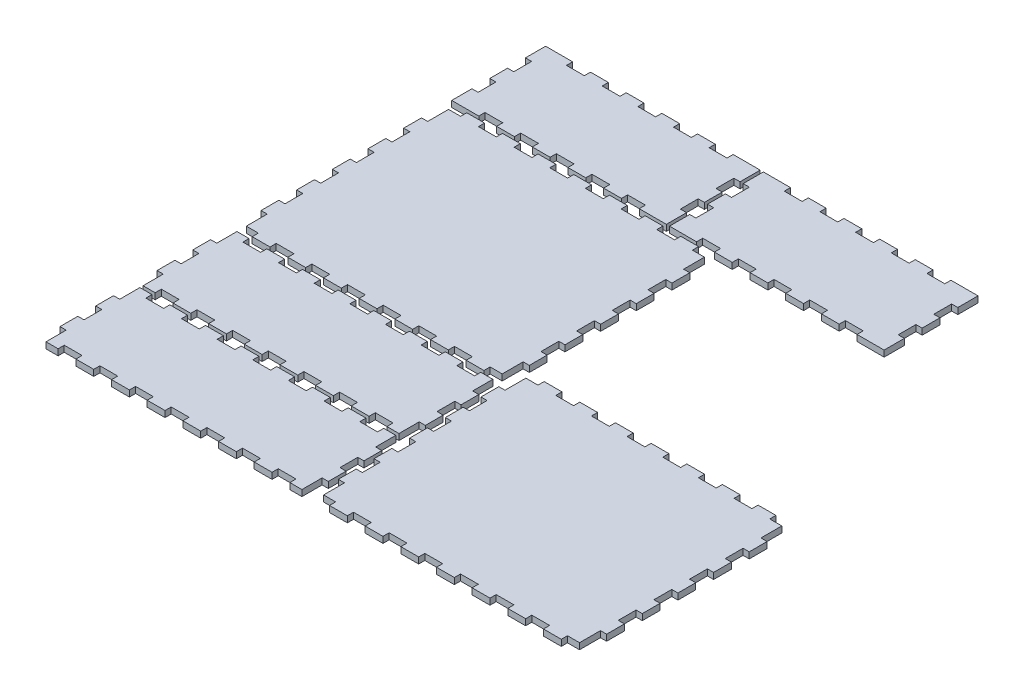
from build123d import *

# Parameters (mm, degrees)
BOSS_EXTRUDE2_DEPTH   = 5.842
BOSS_EXTRUDE2_2_DEPTH = 5.842
BOSS_EXTRUDE2_3_DEPTH = 5.842
BOSS_EXTRUDE2_4_DEPTH = 5.842
BOSS_EXTRUDE2_5_DEPTH = 5.842
BOSS_EXTRUDE2_6_DEPTH = 5.842


with BuildPart() as part:
    # Sketch6 → Boss-Extrude2 (new body)
    with BuildSketch(Plane(origin=(0, 0, 0), x_dir=(1, 0, 0), z_dir=(0, 1, 0))):
        Polygon((45.5168, 481.8888), (45.5168, 476.0468), (28.6258, 476.0468), (28.6258, 481.8888), (8.8392, 481.8888), (2.9972, 481.8888), (2.9972, 476.0468), (2.9972, 462.7626), (8.8392, 462.7626), (8.8392, 445.897), (2.9972, 445.897), (2.9972, 429.006), (8.8392, 429.006), (8.8392, 412.1404), (2.9972, 412.1404), (2.9972, 398.8308), (2.9972, 392.9888), (8.8392, 392.9888), (28.6258, 392.9888), (28.6258, 398.8308), (45.5168, 398.8308), (45.5168, 392.9888), (62.4078, 392.9888), (62.4078, 398.8308), (79.2734, 398.8308), (79.2734, 392.9888), (96.1644, 392.9888), (96.1644, 398.8308), (113.03, 398.8308), (113.03, 392.9888), (129.921, 392.9888), (129.921, 398.8308), (146.812, 398.8308), (146.812, 392.9888), (163.6776, 392.9888), (163.6776, 398.8308), (180.5686, 398.8308), (180.5686, 392.9888), (200.3552, 392.9888), (206.1972, 392.9888), (206.1972, 398.8308), (206.1972, 412.1404), (200.3552, 412.1404), (200.3552, 429.006), (206.1972, 429.006), (206.1972, 445.897), (200.3552, 445.897), (200.3552, 462.7626), (206.1972, 462.7626), (206.1972, 476.0468), (206.1972, 481.8888), (200.3552, 481.8888), (180.5686, 481.8888), (180.5686, 476.0468), (163.6776, 476.0468), (163.6776, 481.8888), (146.812, 481.8888), (146.812, 476.0468), (129.921, 476.0468), (129.921, 481.8888), (113.03, 481.8888), (113.03, 476.0468), (96.1644, 476.0468), (96.1644, 481.8888), (79.2734, 481.8888), (79.2734, 476.0468), (62.4078, 476.0468), (62.4078, 481.8888), align=None)
    extrude(amount=BOSS_EXTRUDE2_DEPTH)


with BuildPart() as body_2:
    # Sketch6 → Boss-Extrude2 2 (new body)
    with BuildSketch(Plane(origin=(0, 0, 0), x_dir=(1, 0, 0), z_dir=(0, 1, 0))):
        Polygon((251.714, 481.8888), (251.714, 476.0468), (234.823, 476.0468), (234.823, 481.8888), (215.0364, 481.8888), (209.1944, 481.8888), (209.1944, 476.0468), (209.1944, 462.7626), (215.0364, 462.7626), (215.0364, 445.897), (209.1944, 445.897), (209.1944, 429.006), (215.0364, 429.006), (215.0364, 412.1404), (209.1944, 412.1404), (209.1944, 398.8308), (209.1944, 392.9888), (215.0364, 392.9888), (234.823, 392.9888), (234.823, 398.8308), (251.714, 398.8308), (251.714, 392.9888), (268.605, 392.9888), (268.605, 398.8308), (285.4706, 398.8308), (285.4706, 392.9888), (302.3616, 392.9888), (302.3616, 398.8308), (319.2272, 398.8308), (319.2272, 392.9888), (336.1182, 392.9888), (336.1182, 398.8308), (353.0092, 398.8308), (353.0092, 392.9888), (369.8748, 392.9888), (369.8748, 398.8308), (386.7658, 398.8308), (386.7658, 392.9888), (406.5524, 392.9888), (412.3944, 392.9888), (412.3944, 398.8308), (412.3944, 412.1404), (406.5524, 412.1404), (406.5524, 429.006), (412.3944, 429.006), (412.3944, 445.897), (406.5524, 445.897), (406.5524, 462.7626), (412.3944, 462.7626), (412.3944, 476.0468), (412.3944, 481.8888), (406.5524, 481.8888), (386.7658, 481.8888), (386.7658, 476.0468), (369.8748, 476.0468), (369.8748, 481.8888), (353.0092, 481.8888), (353.0092, 476.0468), (336.1182, 476.0468), (336.1182, 481.8888), (319.2526, 481.8888), (319.2526, 476.0468), (302.3616, 476.0468), (302.3616, 481.8888), (285.4706, 481.8888), (285.4706, 476.0468), (268.605, 476.0468), (268.605, 481.8888), align=None)
    extrude(amount=BOSS_EXTRUDE2_2_DEPTH)


with BuildPart() as body_3:
    # Sketch6 → Boss-Extrude2 3 (new body)
    with BuildSketch(Plane(origin=(0, 0, 0), x_dir=(1, 0, 0), z_dir=(0, 1, 0))):
        Polygon((256.9972, 296.8498), (251.1552, 296.8498), (251.1552, 313.7154), (256.9972, 313.7154), (256.9972, 330.6064), (251.1552, 330.6064), (251.1552, 347.4974), (256.9972, 347.4974), (256.9972, 364.363), (251.1552, 364.363), (251.1552, 384.1496), (239.7252, 384.1496), (239.7252, 389.9916), (222.8596, 389.9916), (222.8596, 384.1496), (205.9686, 384.1496), (205.9686, 389.9916), (189.0776, 389.9916), (189.0776, 384.1496), (172.212, 384.1496), (172.212, 389.9916), (155.321, 389.9916), (155.321, 384.1496), (138.43, 384.1496), (138.43, 389.9916), (121.5644, 389.9916), (121.5644, 384.1496), (104.6734, 384.1496), (104.6734, 389.9916), (87.8078, 389.9916), (87.8078, 384.1496), (70.9168, 384.1496), (70.9168, 389.9916), (54.0258, 389.9916), (54.0258, 384.1496), (37.1602, 384.1496), (37.1602, 389.9916), (20.2692, 389.9916), (20.2692, 384.1496), (8.8392, 384.1496), (8.8392, 364.363), (2.9972, 364.363), (2.9972, 347.4974), (8.8392, 347.4974), (8.8392, 330.6064), (2.9972, 330.6064), (2.9972, 313.7154), (8.8392, 313.7154), (8.8392, 296.8498), (2.9972, 296.8498), (2.9972, 279.9588), (8.8392, 279.9588), (8.8392, 263.0678), (2.9972, 263.0678), (2.9972, 246.2022), (8.8392, 246.2022), (8.8392, 229.3112), (2.9972, 229.3112), (2.9972, 212.4456), (8.8392, 212.4456), (8.8392, 192.6336), (20.2692, 192.6336), (20.2692, 186.7916), (37.1602, 186.7916), (37.1602, 192.6336), (54.0258, 192.6336), (54.0258, 186.7916), (70.9168, 186.7916), (70.9168, 192.6336), (87.8078, 192.6336), (87.8078, 186.7916), (104.6734, 186.7916), (104.6734, 192.6336), (121.5644, 192.6336), (121.5644, 186.7916), (138.43, 186.7916), (138.43, 192.6336), (155.321, 192.6336), (155.321, 186.7916), (172.212, 186.7916), (172.212, 192.6336), (189.0776, 192.6336), (189.0776, 186.7916), (205.9686, 186.7916), (205.9686, 192.6336), (222.8596, 192.6336), (222.8596, 186.7916), (239.7252, 186.7916), (239.7252, 192.6336), (251.1552, 192.6336), (251.1552, 212.4456), (256.9972, 212.4456), (256.9972, 229.3112), (251.1552, 229.3112), (251.1552, 246.2022), (256.9972, 246.2022), (256.9972, 263.0678), (251.1552, 263.0678), (251.1552, 279.9588), (256.9972, 279.9588), align=None)
    extrude(amount=BOSS_EXTRUDE2_3_DEPTH)


with BuildPart() as body_4:
    # Sketch6 → Boss-Extrude2 4 (new body)
    with BuildSketch(Plane(origin=(0, 0, 0), x_dir=(1, 0, 0), z_dir=(0, 1, 0))):
        Polygon((311.023, 206.1972), (311.023, 200.3552), (294.1574, 200.3552), (294.1574, 206.1972), (277.2664, 206.1972), (277.2664, 200.3552), (265.8364, 200.3552), (265.8364, 180.5686), (259.9944, 180.5686), (259.9944, 163.6776), (265.8364, 163.6776), (265.8364, 146.812), (259.9944, 146.812), (259.9944, 129.921), (265.8364, 129.921), (265.8364, 113.03), (259.9944, 113.03), (259.9944, 96.1644), (265.8364, 96.1644), (265.8364, 79.2734), (259.9944, 79.2734), (259.9944, 62.4078), (265.8364, 62.4078), (265.8364, 45.5168), (259.9944, 45.5168), (259.9944, 28.6258), (265.8364, 28.6258), (265.8364, 8.8392), (277.2664, 8.8392), (277.2664, 2.9972), (294.1574, 2.9972), (294.1574, 8.8392), (311.023, 8.8392), (311.023, 2.9972), (327.914, 2.9972), (327.914, 8.8392), (344.805, 8.8392), (344.805, 2.9972), (361.6706, 2.9972), (361.6706, 8.8392), (378.5616, 8.8392), (378.5616, 2.9972), (395.4526, 2.9972), (395.4526, 8.8392), (412.3182, 8.8392), (412.3182, 2.9972), (429.2092, 2.9972), (429.2092, 8.8392), (446.0748, 8.8392), (446.0748, 2.9972), (462.9658, 2.9972), (462.9658, 8.8392), (479.8568, 8.8392), (479.8568, 2.9972), (496.7224, 2.9972), (496.7224, 8.8392), (508.1524, 8.8392), (508.1524, 28.6258), (513.9944, 28.6258), (513.9944, 45.5168), (508.1524, 45.5168), (508.1524, 62.4078), (513.9944, 62.4078), (513.9944, 79.2734), (508.1524, 79.2734), (508.1524, 96.1644), (513.9944, 96.1644), (513.9944, 113.03), (508.1524, 113.03), (508.1524, 129.921), (513.9944, 129.921), (513.9944, 146.812), (508.1524, 146.812), (508.1524, 163.6776), (513.9944, 163.6776), (513.9944, 180.5686), (508.1524, 180.5686), (508.1524, 200.3552), (496.7224, 200.3552), (496.7224, 206.1972), (479.8568, 206.1972), (479.8568, 200.3552), (462.9658, 200.3552), (462.9658, 206.1972), (446.0748, 206.1972), (446.0748, 200.3552), (429.2092, 200.3552), (429.2092, 206.1972), (412.3182, 206.1972), (412.3182, 200.3552), (395.4526, 200.3552), (395.4526, 206.1972), (378.5616, 206.1972), (378.5616, 200.3552), (361.6706, 200.3552), (361.6706, 206.1972), (344.805, 206.1972), (344.805, 200.3552), (327.914, 200.3552), (327.914, 206.1972), align=None)
    extrude(amount=BOSS_EXTRUDE2_4_DEPTH)


with BuildPart() as body_5:
    # Sketch6 → Boss-Extrude2 5 (new body)
    with BuildSketch(Plane(origin=(0, 0, 0), x_dir=(1, 0, 0), z_dir=(0, 1, 0))):
        Polygon((2.9972, 147.8026), (8.8392, 147.8026), (8.8392, 130.9116), (2.9972, 130.9116), (2.9972, 114.0206), (8.8392, 114.0206), (8.8392, 100.7364), (8.8392, 94.8944), (20.2692, 94.8944), (20.2692, 100.7364), (37.1602, 100.7364), (37.1602, 94.8944), (54.0258, 94.8944), (54.0258, 100.7364), (70.9168, 100.7364), (70.9168, 94.8944), (87.8078, 94.8944), (87.8078, 100.7364), (104.6734, 100.7364), (104.6734, 94.8944), (121.5644, 94.8944), (121.5644, 100.7364), (138.43, 100.7364), (138.43, 94.8944), (155.321, 94.8944), (155.321, 100.7364), (172.212, 100.7364), (172.212, 94.8944), (189.0776, 94.8944), (189.0776, 100.7364), (205.9686, 100.7364), (205.9686, 94.8944), (222.8596, 94.8944), (222.8596, 100.7364), (239.7252, 100.7364), (239.7252, 94.8944), (251.1552, 94.8944), (251.1552, 100.7364), (251.1552, 114.0206), (256.9972, 114.0206), (256.9972, 130.9116), (251.1552, 130.9116), (251.1552, 147.8026), (256.9972, 147.8026), (256.9972, 164.6682), (251.1552, 164.6682), (251.1552, 177.9524), (251.1552, 183.7944), (239.7252, 183.7944), (239.7252, 177.9524), (222.8596, 177.9524), (222.8596, 183.7944), (205.9686, 183.7944), (205.9686, 177.9524), (189.0776, 177.9524), (189.0776, 183.7944), (172.212, 183.7944), (172.212, 177.9524), (155.321, 177.9524), (155.321, 183.7944), (138.43, 183.7944), (138.43, 177.9524), (121.5644, 177.9524), (121.5644, 183.7944), (104.6734, 183.7944), (104.6734, 177.9524), (87.8078, 177.9524), (87.8078, 183.7944), (70.9168, 183.7944), (70.9168, 177.9524), (54.0258, 177.9524), (54.0258, 183.7944), (37.1602, 183.7944), (37.1602, 177.9524), (20.2692, 177.9524), (20.2692, 183.7944), (8.8392, 183.7944), (8.8392, 177.9524), (8.8392, 164.6682), (2.9972, 164.6682), align=None)
    extrude(amount=BOSS_EXTRUDE2_5_DEPTH)


with BuildPart() as body_6:
    # Sketch6 → Boss-Extrude2 6 (new body)
    with BuildSketch(Plane(origin=(0, 0, 0), x_dir=(1, 0, 0), z_dir=(0, 1, 0))):
        Polygon((54.0258, 2.9972), (54.0258, 8.8392), (70.9168, 8.8392), (70.9168, 2.9972), (87.8078, 2.9972), (87.8078, 8.8392), (104.6734, 8.8392), (104.6734, 2.9972), (121.5644, 2.9972), (121.5644, 8.8392), (138.43, 8.8392), (138.43, 2.9972), (155.321, 2.9972), (155.321, 8.8392), (172.212, 8.8392), (172.212, 2.9972), (189.0776, 2.9972), (189.0776, 8.8392), (205.9686, 8.8392), (205.9686, 2.9972), (222.8596, 2.9972), (222.8596, 8.8392), (239.7252, 8.8392), (239.7252, 2.9972), (251.1552, 2.9972), (251.1552, 8.8392), (251.1552, 22.1234), (256.9972, 22.1234), (256.9972, 39.0144), (251.1552, 39.0144), (251.1552, 55.88), (256.9972, 55.88), (256.9972, 72.771), (251.1552, 72.771), (251.1552, 86.0552), (251.1552, 91.8972), (239.7252, 91.8972), (239.7252, 86.0552), (222.8596, 86.0552), (222.8596, 91.8972), (205.9686, 91.8972), (205.9686, 86.0552), (189.0776, 86.0552), (189.0776, 91.8972), (172.212, 91.8972), (172.212, 86.0552), (155.321, 86.0552), (155.321, 91.8972), (138.43, 91.8972), (138.43, 86.0552), (121.5644, 86.0552), (121.5644, 91.8972), (104.6734, 91.8972), (104.6734, 86.0552), (87.8078, 86.0552), (87.8078, 91.8972), (70.9168, 91.8972), (70.9168, 86.0552), (54.0258, 86.0552), (54.0258, 91.8972), (37.1602, 91.8972), (37.1602, 86.0552), (20.2692, 86.0552), (20.2692, 91.8972), (8.8392, 91.8972), (8.8392, 86.0552), (8.8392, 72.771), (2.9972, 72.771), (2.9972, 55.88), (8.8392, 55.88), (8.8392, 39.0144), (2.9972, 39.0144), (2.9972, 22.1234), (8.8392, 22.1234), (8.8392, 8.8392), (8.8392, 2.9972), (20.2692, 2.9972), (20.2692, 8.8392), (37.1602, 8.8392), (37.1602, 2.9972), align=None)
    extrude(amount=BOSS_EXTRUDE2_6_DEPTH)


solid = Compound([part.part, body_2.part, body_3.part, body_4.part, body_5.part, body_6.part])
